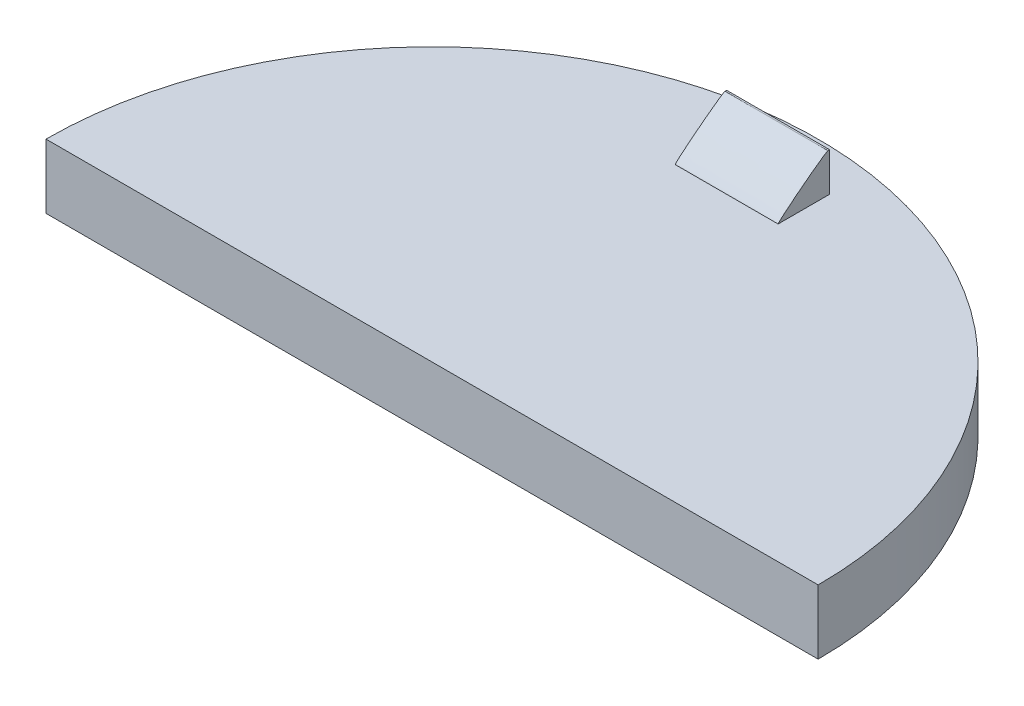
from build123d import *

# Parameters (mm, degrees)
BOSS_EXTRUDE1_DEPTH = 5
SKETCH3_W           = 8
SKETCH3_H           = 4
BOSS_EXTRUDE2_DEPTH = 3
FILLET1_START       = -3.841593316
FILLET1_DEPTH       = 8


with BuildPart() as part:
    # Sketch1 → Boss-Extrude1 (new body)
    with BuildSketch(Plane(origin=(0, 0, 0), x_dir=(1, 0, 0), z_dir=(0, 1, 0))):
        with BuildLine():
            Line((-30, 0), (30, 0))
            ThreePointArc((30, 0), (0, 30), (-30, 0))
        make_face()
    extrude(amount=BOSS_EXTRUDE1_DEPTH)

    # Sketch3 → Boss-Extrude2 (add)
    with BuildSketch(Plane(origin=(0, 5, 0), x_dir=(1, 0, 0), z_dir=(0, 1, 0))):
        with Locations((0.158406684, 24.731666579)):
            Rectangle(SKETCH3_W, SKETCH3_H)
    extrude(amount=BOSS_EXTRUDE2_DEPTH)

    # Fillet1: read off the stored shape, not the designer's step
    # Fillet1 outline → Fillet1 (cut)
    with BuildSketch(Plane.YZ.offset(FILLET1_START)):
        with BuildLine():
            Line((8, -22.731666579), (5, -22.731666579))
            add(Edge.make_bspline(
                [(5, -22.731666579), (8, -23.506263249), (8, -26.604649926)],
                knots=[0, 0, 0, 1, 1, 1], degree=2, weights=[1, 0.057495957, 1]))
            Line((8, -26.604649926), (8, -22.731666579))
        make_face()
    extrude(amount=FILLET1_DEPTH, mode=Mode.SUBTRACT)


solid = part.part
